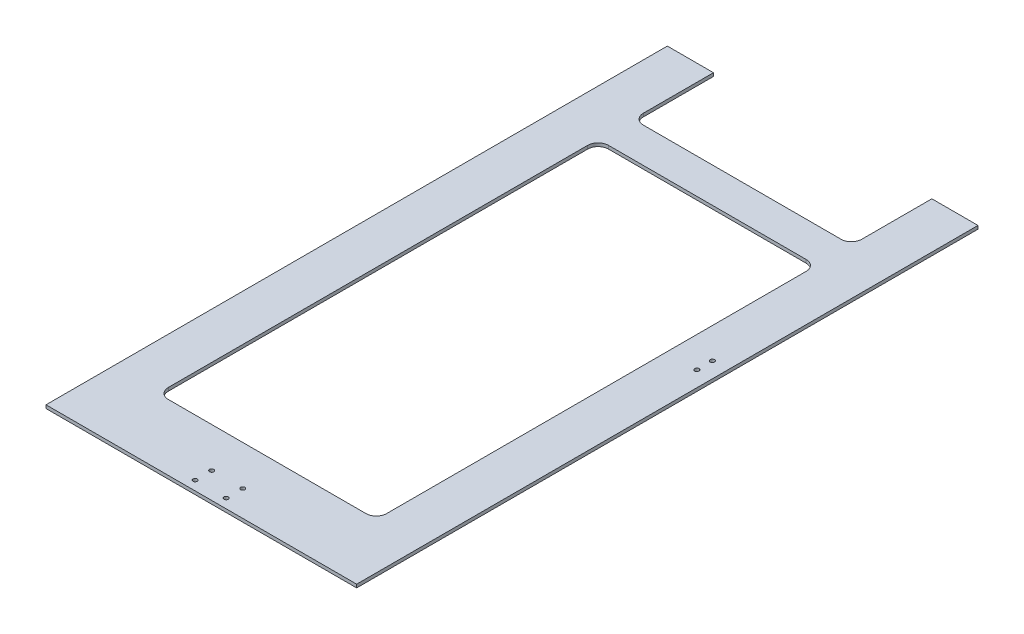
from build123d import *

# Parameters (mm, degrees)
SKETCH1_W           = 300
SKETCH1_H           = 600
BOSS_EXTRUDE1_DEPTH = 3.175
CUT_EXTRUDE1_DEPTH  = 10
SKETCH4_R           = 2.05
CUT_EXTRUDE2_DEPTH  = 51
SKETCH5_R           = 2.1
CUT_EXTRUDE3_DEPTH  = 67


with BuildPart() as part:
    # Sketch1 → Boss-Extrude1 (new body)
    with BuildSketch(Plane(origin=(0, 0, 0), x_dir=(1, 0, 0), z_dir=(0, 1, 0))):
        Rectangle(SKETCH1_W, SKETCH1_H)
    extrude(amount=BOSS_EXTRUDE1_DEPTH)

    # Sketch3 → Cut-Extrude1 (cut)
    with BuildSketch(Plane(origin=(0, 3.175, 0), x_dir=(1, 0, 0), z_dir=(0, 1, 0))):
        with BuildLine():
            Line((-95.445664395, -236.484492038), (95.445664395, -236.484492038))
            ThreePointArc((95.445664395, -236.484492038), (102.516732207, -233.55555985), (105.445664395, -226.484492038))
            Line((105.445664395, -226.484492038), (105.445664395, 178.578479092))
            ThreePointArc((105.445664395, 178.578479092), (102.516732207, 185.649546903), (95.445664395, 188.578479092))
            Line((95.445664395, 188.578479092), (-95.445664395, 188.578479092))
            ThreePointArc((-95.445664395, 188.578479092), (-102.516732207, 185.649546903), (-105.445664395, 178.578479092))
            Line((-105.445664395, 178.578479092), (-105.445664395, -226.484492038))
            ThreePointArc((-105.445664395, -226.484492038), (-102.516732207, -233.55555985), (-95.445664395, -236.484492038))
        make_face()
        with BuildLine():
            Line((105.445664395, 338.770518263), (105.445664395, 232.318098583))
            ThreePointArc((105.445664395, 232.318098583), (102.516732207, 225.247030771), (95.445664395, 222.318098583))
            Line((95.445664395, 222.318098583), (-95.445664395, 222.318098583))
            ThreePointArc((-95.445664395, 222.318098583), (-102.516732207, 225.247030771), (-105.445664395, 232.318098583))
            Line((-105.445664395, 232.318098583), (-105.445664395, 338.770518263))
            ThreePointArc((-105.445664395, 338.770518263), (-102.516732207, 345.841586075), (-95.445664395, 348.770518263))
            Line((-95.445664395, 348.770518263), (95.445664395, 348.770518263))
            ThreePointArc((95.445664395, 348.770518263), (102.516732207, 345.841586075), (105.445664395, 338.770518263))
        make_face()
    extrude(amount=-CUT_EXTRUDE1_DEPTH, mode=Mode.SUBTRACT)

    # Sketch4 → Cut-Extrude2 (cut)
    with BuildSketch(Plane(origin=(0, 3.175, 0), x_dir=(1, 0, 0), z_dir=(0, 1, 0))):
        with Locations((15, -291)):
            Circle(SKETCH4_R)
        with Locations((-15, -291)):
            Circle(SKETCH4_R)
        with Locations((-15, -275)):
            Circle(SKETCH4_R)
        with Locations((15, -275)):
            Circle(SKETCH4_R)
    extrude(amount=-CUT_EXTRUDE2_DEPTH, mode=Mode.SUBTRACT)

    # Sketch5 → Cut-Extrude3 (cut)
    with BuildSketch(Plane(origin=(0, 3.175, 0), x_dir=(1, 0, 0), z_dir=(0, 1, 0))):
        with Locations((135, 43.495009338)):
            Circle(SKETCH5_R)
        with Locations((135, 58.495009338)):
            Circle(SKETCH5_R)
    extrude(amount=-CUT_EXTRUDE3_DEPTH, mode=Mode.SUBTRACT)


solid = part.part
